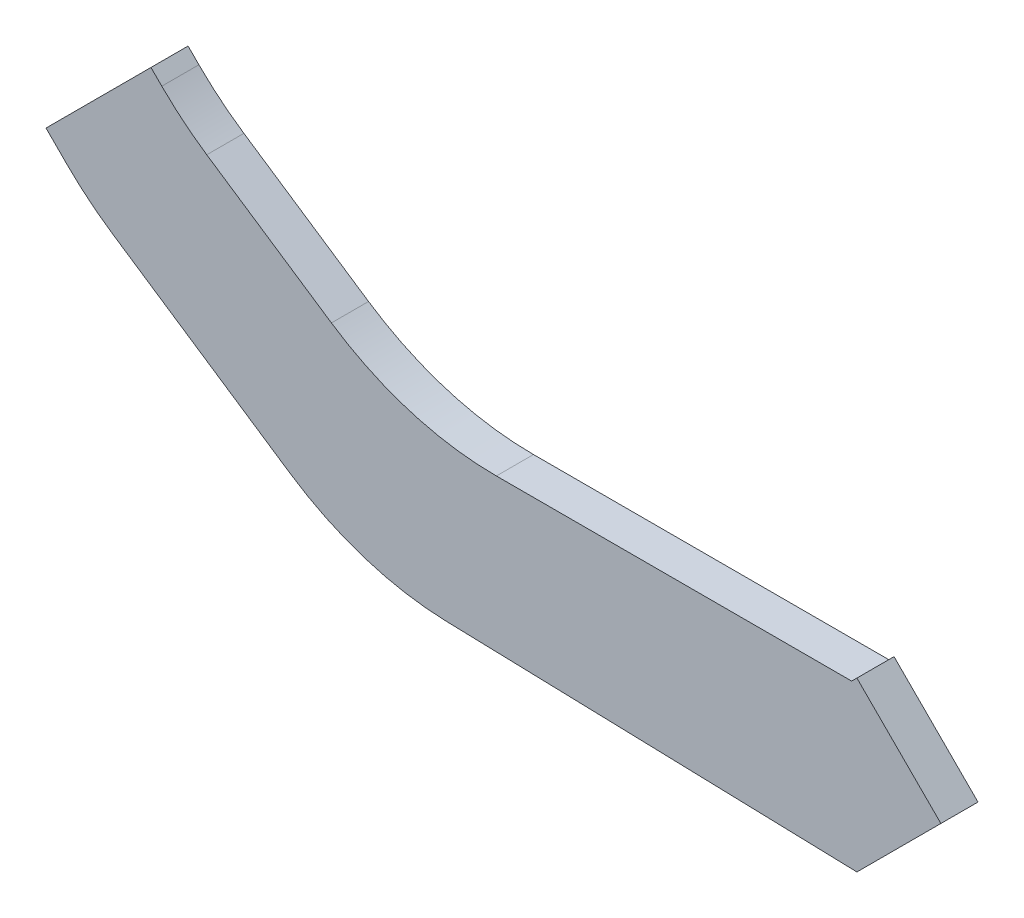
from build123d import *

# Parameters (mm, degrees)
BOSS_EXTRUDE1_DEPTH = 0.125
FILLET1_R           = 2


with BuildPart() as part:
    # frame_outline → Boss-Extrude1 (new, symmetric)
    with BuildSketch(Plane.XY):
        Polygon((-1.803122292, -1.87383297), (-1.590990258, -2.085965005), (-0.083184528, -3.093592168), (2.916815472, -3.093592168), (2.952170811, -3.058236829), (3.517856236, -3.623922254), (2.952170811, -4.189607679), (-0.386567156, -4.093592168), (-2.2284766, -2.862692224), (-2.510229073, -2.580939751), align=None)
    extrude(amount=BOSS_EXTRUDE1_DEPTH, both=True)

    # Fillet1
    fillet1_edges = [part.edges().sort_by_distance(p)[0] for p in [
        (-2.2284766, -2.862692224, 0),
        (-0.386567156, -4.093592168, 0),
        (-1.590990258, -2.085965005, 0),
        (-0.083184528, -3.093592168, 0),
    ]]
    fillet(fillet1_edges, radius=FILLET1_R)


solid = part.part
